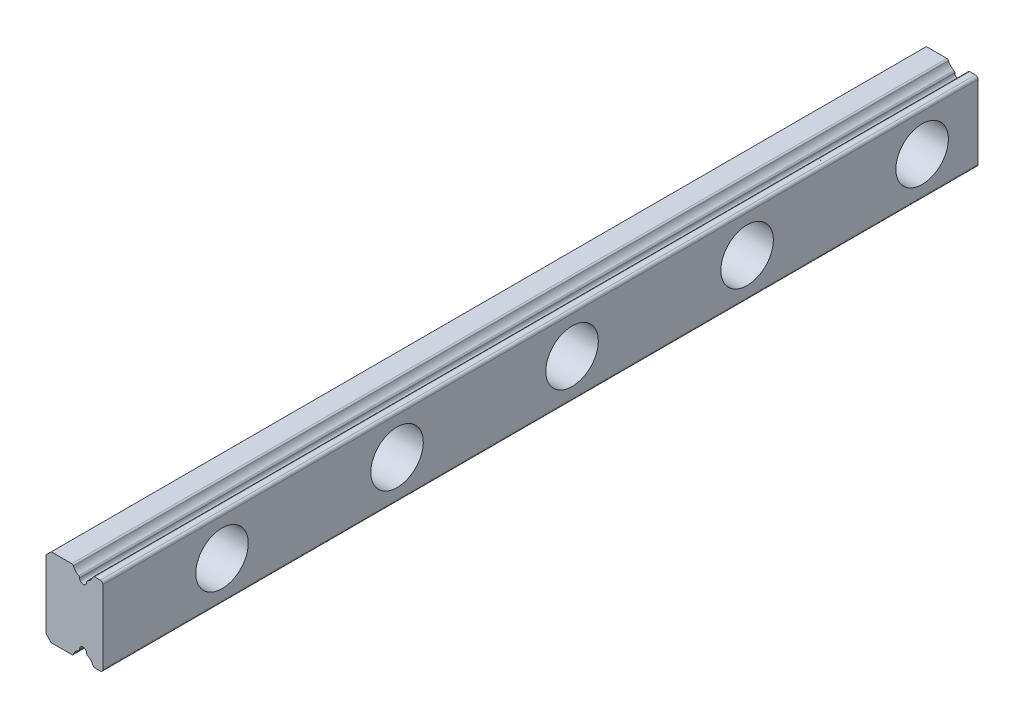
from build123d import *

# Parameters (mm, degrees)
EXTRUDE_1_DEPTH     = 100
SKETCH_2_R          = 1.75
CUT_EXTRUDE_1_DEPTH = 100
SKETCH_3_R          = 3
CUT_EXTRUDE_2_DEPTH = 4.5


with BuildPart() as part:
    # 草图1 → 凸台-拉伸1 (new body)
    with BuildSketch(Plane.XY):
        with BuildLine():
            Line((2.95, 4.5), (2.307669683, 4.5))
            ThreePointArc((2.307669683, 4.5), (2.194280341, 4.464750894), (2.120859728, 4.371428571))
            ThreePointArc((2.120859728, 4.371428571), (1.880846451, 3.985070843), (1.514285714, 3.715790517))
            ThreePointArc((1.514285714, 3.715790517), (1.430969149, 3.641993433), (1.4, 3.535088936))
            Line((1.4, 3.535088936), (1.4, 3.5))
            ThreePointArc((1.4, 3.5), (1, 3.1), (0.6, 3.5))
            Line((0.6, 3.5), (0.6, 3.535088936))
            ThreePointArc((0.6, 3.535088936), (0.569030851, 3.641993433), (0.485714286, 3.715790517))
            ThreePointArc((0.485714286, 3.715790517), (0.119153549, 3.985070843), (-0.120859728, 4.371428571))
            ThreePointArc((-0.120859728, 4.371428571), (-0.194280341, 4.464750894), (-0.307669683, 4.5))
            Line((-0.307669683, 4.5), (-2.65, 4.5))
            Line((-2.65, 4.5), (-3.25, 3.9))
            Line((-3.25, 3.9), (-3.25, -3.9))
            Line((-3.25, -3.9), (-2.65, -4.5))
            Line((-2.65, -4.5), (-0.307669683, -4.5))
            ThreePointArc((-0.307669683, -4.5), (-0.194280341, -4.464750894), (-0.120859728, -4.371428571))
            ThreePointArc((-0.120859728, -4.371428571), (0.119153549, -3.985070843), (0.485714286, -3.715790517))
            ThreePointArc((0.485714286, -3.715790517), (0.569030851, -3.641993433), (0.6, -3.535088936))
            Line((0.6, -3.535088936), (0.6, -3.5))
            ThreePointArc((0.6, -3.5), (1, -3.1), (1.4, -3.5))
            Line((1.4, -3.5), (1.4, -3.535088936))
            ThreePointArc((1.4, -3.535088936), (1.430969149, -3.641993433), (1.514285714, -3.715790517))
            ThreePointArc((1.514285714, -3.715790517), (1.880846451, -3.985070843), (2.120859728, -4.371428571))
            ThreePointArc((2.120859728, -4.371428571), (2.194280341, -4.464750894), (2.307669683, -4.5))
            Line((2.307669683, -4.5), (2.95, -4.5))
            ThreePointArc((2.95, -4.5), (3.162132034, -4.412132034), (3.25, -4.2))
            Line((3.25, -4.2), (3.25, 4.2))
            ThreePointArc((3.25, 4.2), (3.162132034, 4.412132034), (2.95, 4.5))
        make_face()
    extrude(amount=EXTRUDE_1_DEPTH)

    # 草图2 → 切除-拉伸1 (cut)
    with BuildSketch(Plane(origin=(3.25, 0, 0), x_dir=(0, 0, -1), z_dir=(1, 0, 0))):
        with Locations((-6.386586206, 0)):
            Circle(SKETCH_2_R)
        with Locations((-26.386586206, 0)):
            Circle(SKETCH_2_R)
        with Locations((-46.386586206, 0)):
            Circle(SKETCH_2_R)
        with Locations((-66.386586206, 0)):
            Circle(SKETCH_2_R)
        with Locations((-86.386586206, 0)):
            Circle(SKETCH_2_R)
    extrude(amount=-CUT_EXTRUDE_1_DEPTH, mode=Mode.SUBTRACT)

    # 草图3 → 切除-拉伸2 (cut)
    with BuildSketch(Plane(origin=(3.25, 0, 0), x_dir=(0, 0, -1), z_dir=(1, 0, 0))):
        with Locations((-6.386586206, 0)):
            Circle(SKETCH_3_R)
        with Locations((-26.386586206, 0)):
            Circle(SKETCH_3_R)
        with Locations((-46.386586206, 0)):
            Circle(SKETCH_3_R)
        with Locations((-66.386586206, 0)):
            Circle(SKETCH_3_R)
        with Locations((-86.386586206, 0)):
            Circle(SKETCH_3_R)
    extrude(amount=-CUT_EXTRUDE_2_DEPTH, mode=Mode.SUBTRACT)


solid = part.part
